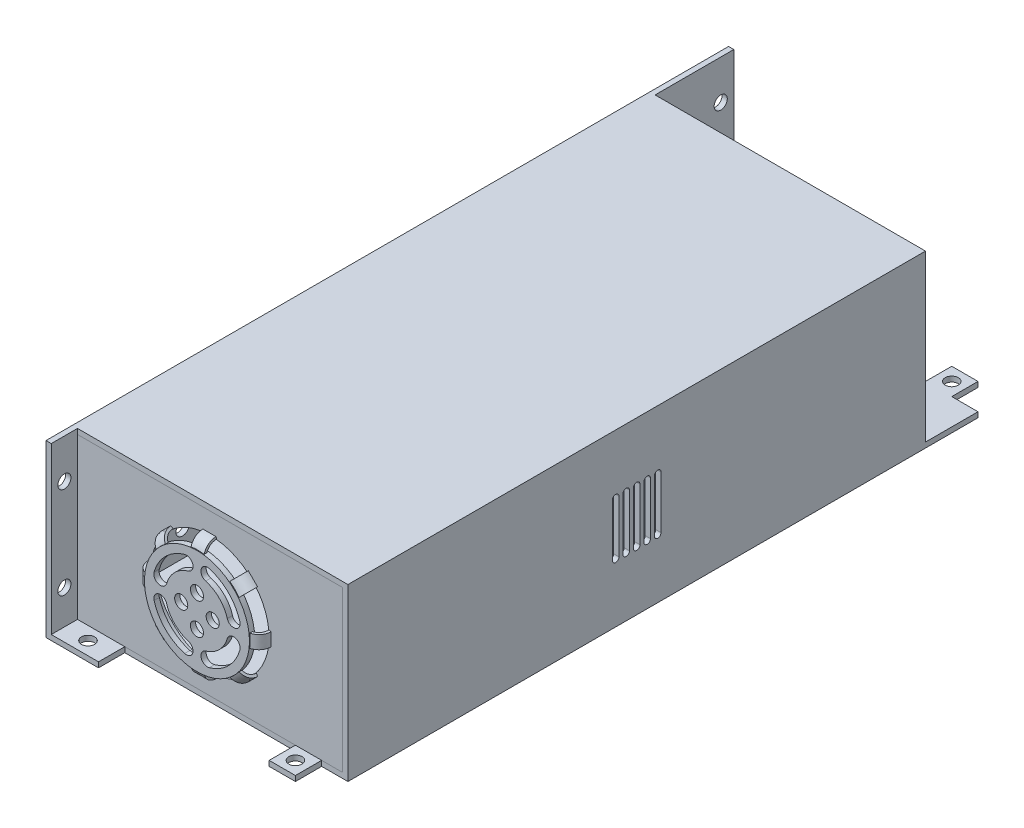
from build123d import *

# Parameters (mm, degrees)
BOARD_OUTLINE_DEPTH                    = 110
BOARD_OUTLINE_DEPTH_BACK               = 110
ESQUISSE1_W                            = 105
ESQUISSE1_H                            = 65
ESQUISSE1_W_2                          = 101
ESQUISSE1_H_2                          = 61
ESQUISSE8_W                            = 101
ESQUISSE8_H                            = 2
BOSS_EXTRU_3_DEPTH                     = 61
BOSS_EXTRU_3_2_DEPTH                   = 61
ESQUISSE2_W                            = 10
ESQUISSE2_H                            = 2
BOSS_EXTRU_2_DEPTH                     = 10
ESQUISSE9_R                            = 22.5
ENL_V_MAT_EXTRU_1_DEPTH                = 2
ESQUISSE10_R                           = 20
ESQUISSE10_R_2                         = 2.5
BOSS_EXTRU_4_DEPTH                     = 2
BALAYAGE4_START                        = -2.5
BALAYAGE4_DEPTH                        = 5
R_P_TITION_CIRCULAIRE8_COUNT           = 8
BOSS_EXTRU_6_DEPTH                     = 30
ESQUISSE17_W                           = 65
ESQUISSE17_H                           = 2
ESQUISSE17_W_2                         = 10
ENL_V_MAT_EXTRU_2_DEPTH                = 10
ESQUISSE18_W                           = 65
ESQUISSE18_H                           = 2
BOSS_EXTRU_7_DEPTH                     = 3
ESQUISSE19_W                           = 82
ESQUISSE19_H                           = 15
BOSS_EXTRU_8_DEPTH                     = 7.5
D_POUILLE2_ANGLE                       = 5
BOSS_EXTRU_10_START                    = -7.5
BOSS_EXTRU_10_DEPTH                    = 10.5
ENL_V_MAT_EXTRU_3_REACH                = 169.152
ENL_V_MAT_EXTRU_4_DEPTH                = 2
ENL_V_MAT_EXTRU_5_DEPTH                = 2
ESQUISSE7_W                            = 2.5
ESQUISSE7_H                            = 2
DIAM_TRE_DU_PER_AGE_5_0_5_2_AT_2_COUNT = 2
DIAM_TRE_DU_PER_AGE_5_0_5_2_AT_2_PITCH = 35
DIAM_TRE_DU_PER_AGE_5_0_5_2_AT_3_COUNT = 2
DIAM_TRE_DU_PER_AGE_5_0_5_2_AT_3_PITCH = 250
DIAM_TRE_DU_PER_AGE_5_0_5_2_AT_4_COUNT = 2
DIAM_TRE_DU_PER_AGE_5_0_5_2_AT_4_PITCH = 252.438111227
ESQUISSE5_W                            = 2.5
ESQUISSE5_H                            = 2
DIAM_TRE_DU_PER_AGE_5_0_5_1_AT_2_COUNT = 2
DIAM_TRE_DU_PER_AGE_5_0_5_1_AT_2_PITCH = 79
DIAM_TRE_DU_PER_AGE_5_0_5_1_AT_3_COUNT = 2
DIAM_TRE_DU_PER_AGE_5_0_5_1_AT_3_PITCH = 250
DIAM_TRE_DU_PER_AGE_5_0_5_1_AT_4_COUNT = 2
DIAM_TRE_DU_PER_AGE_5_0_5_1_AT_4_PITCH = 262.185049154
ESQUISSE24_R                           = 2.5
ENL_V_MAT_EXTRU_6_DEPTH                = 2


with BuildPart() as part:
    # Esquisse1 → Board_Outline (new, two sides: drawn at the far end of the back side and taken through both)
    with BuildSketch(Plane.XY.offset(-BOARD_OUTLINE_DEPTH_BACK)):
        Rectangle(ESQUISSE1_W, ESQUISSE1_H)
        Rectangle(ESQUISSE1_W_2, ESQUISSE1_H_2, mode=Mode.SUBTRACT)
    extrude(amount=BOARD_OUTLINE_DEPTH + BOARD_OUTLINE_DEPTH_BACK)

    # Esquisse2 → Boss.-Extru.2 (add)
    with BuildSketch(Plane.XY.offset(110)):
        Polygon((-52.5, 32.5), (-50.5, 32.5), (-50.5, -30.5), (-42.5, -30.5), (-32.5, -30.5), (-32.5, -32.5), (-52.5, -32.5), align=None)
        with Locations((37.5, -31.5)):
            Rectangle(ESQUISSE2_W, ESQUISSE2_H)
    extrude(amount=BOSS_EXTRU_2_DEPTH)



with BuildPart() as body_2:
    # Esquisse8 → Boss.-Extru.3 (new body)
    with BuildSketch(Plane(origin=(0, -30.5, 0), x_dir=(1, 0, 0), z_dir=(0, 1, 0))):
        with Locations((0, -109)):
            Rectangle(ESQUISSE8_W, ESQUISSE8_H)
    extrude(amount=BOSS_EXTRU_3_DEPTH)

    # Esquisse9 → Enlèv. mat.-Extru.1 (cut)
    with BuildSketch(Plane.XY.offset(110)):
        Circle(ESQUISSE9_R)
    extrude(amount=-ENL_V_MAT_EXTRU_1_DEPTH, mode=Mode.SUBTRACT)


with BuildPart() as body_3:
    # Esquisse8 → Boss.-Extru.3 2 (new body)
    with BuildSketch(Plane(origin=(0, -30.5, 0), x_dir=(1, 0, 0), z_dir=(0, 1, 0))):
        with Locations((0, 109)):
            Rectangle(ESQUISSE8_W, ESQUISSE8_H)
    extrude(amount=BOSS_EXTRU_3_2_DEPTH)


with BuildPart() as body_4:
    # Esquisse10 → Boss.-Extru.4 (new body)
    with BuildSketch(Plane.XY.offset(113)):
        Circle(ESQUISSE10_R)
        with Locations((-6, 0)):
            Circle(ESQUISSE10_R_2, mode=Mode.SUBTRACT)
        with Locations((0, -6)):
            Circle(ESQUISSE10_R_2, mode=Mode.SUBTRACT)
        with Locations((6, 0)):
            Circle(ESQUISSE10_R_2, mode=Mode.SUBTRACT)
        with Locations((0, 6)):
            Circle(ESQUISSE10_R_2, mode=Mode.SUBTRACT)
        with BuildLine():
            ThreePointArc((-16.340352945, 4.689655172), (-14.627015037, 1.59700692), (-11.534366785, 3.310344828))
            ThreePointArc((-11.534366785, 3.310344828), (-8.485281374, 8.485281374), (-3.310344828, 11.534366785))
            ThreePointArc((-3.310344828, 11.534366785), (-1.59700692, 14.627015037), (-4.689655172, 16.340352945))
            ThreePointArc((-4.689655172, 16.340352945), (-12.02081528, 12.02081528), (-16.340352945, 4.689655172))
        make_face(mode=Mode.SUBTRACT)
        with BuildLine():
            ThreePointArc((-4.689655172, -16.340352945), (-1.59700692, -14.627015037), (-3.310344828, -11.534366785))
            ThreePointArc((-3.310344828, -11.534366785), (-8.485281374, -8.485281374), (-11.534366785, -3.310344828))
            ThreePointArc((-11.534366785, -3.310344828), (-14.627015037, -1.59700692), (-16.340352945, -4.689655172))
            ThreePointArc((-16.340352945, -4.689655172), (-12.02081528, -12.02081528), (-4.689655172, -16.340352945))
        make_face(mode=Mode.SUBTRACT)
        with BuildLine():
            ThreePointArc((16.340352945, -4.689655172), (14.627015037, -1.59700692), (11.534366785, -3.310344828))
            ThreePointArc((11.534366785, -3.310344828), (8.485281374, -8.485281374), (3.310344828, -11.534366785))
            ThreePointArc((3.310344828, -11.534366785), (1.59700692, -14.627015037), (4.689655172, -16.340352945))
            ThreePointArc((4.689655172, -16.340352945), (12.02081528, -12.02081528), (16.340352945, -4.689655172))
        make_face(mode=Mode.SUBTRACT)
        with BuildLine():
            ThreePointArc((4.689655172, 16.340352945), (1.59700692, 14.627015037), (3.310344828, 11.534366785))
            ThreePointArc((3.310344828, 11.534366785), (8.485281374, 8.485281374), (11.534366785, 3.310344828))
            ThreePointArc((11.534366785, 3.310344828), (14.627015037, 1.59700692), (16.340352945, 4.689655172))
            ThreePointArc((16.340352945, 4.689655172), (12.02081528, 12.02081528), (4.689655172, 16.340352945))
        make_face(mode=Mode.SUBTRACT)
    extrude(amount=BOSS_EXTRU_4_DEPTH)

    # Balayage4: read off the stored shape, not the designer's step
    # Balayage4 outline → Balayage4 (add)
    with BuildSketch(Plane.YZ.offset(BALAYAGE4_START)):
        with BuildLine():
            Line((19.843134833, 114.77639353), (19.843134833, 113.741976702))
            add(Edge.make_bspline(
                [(19.843134833, 113.741976702), (21.544780484, 113.090833593), (22.422861696, 111.843508026), (22.477378468, 110)],
                knots=[0.133241365, 0.133241365, 0.133241365, 0.133241365, 1, 1, 1, 1], degree=3))
            Line((22.477378468, 110), (23.442609024, 110.261400026))
            add(Edge.make_bspline(
                [(19.843134833, 114.77639353), (20.750508789, 114.482186365), (21.536353529, 114.03620951), (22.928625588, 112.594403676), (23.365671369, 111.488628902), (23.442609024, 110.261400026)],
                knots=[0.114905145, 0.114905145, 0.114905145, 0.114905145, 0.5, 0.5, 1, 1, 1, 1], degree=3))
        make_face()
    balayage4 = extrude(amount=BALAYAGE4_DEPTH)

    # Répétition circulaire8: Balayage4 ×8 about axis
    r_p_tition_circulaire8_axis = Axis((0, 0, 113), (0, 0, 1))
    for i in range(1, R_P_TITION_CIRCULAIRE8_COUNT):
        add(balayage4.rotate(r_p_tition_circulaire8_axis, i * 360 / R_P_TITION_CIRCULAIRE8_COUNT))


with BuildPart() as part_1:
    add(part.part)

    add(body_3.part)  # Boss.-Extru.6 merges body 3
    # Esquisse15 → Boss.-Extru.6 (add)
    with BuildSketch(Plane(origin=(0, 0, -110), x_dir=(-1, 0, 0), z_dir=(0, 0, -1))):
        Polygon((-52.5, -32.5), (52.5, -32.5), (52.5, 32.5), (50.5, 32.5), (50.5, 30.5), (50.5, -30.5), (-50.5, -30.5), (-52.5, -30.5), align=None)
    extrude(amount=BOSS_EXTRU_6_DEPTH)

    # Esquisse17 → Enlèv. mat.-Extru.2 (cut)
    with BuildSketch(Plane(origin=(0, 0, -140), x_dir=(-1, 0, 0), z_dir=(0, 0, -1))):
        with Locations((0, -31.5)):
            Rectangle(ESQUISSE17_W, ESQUISSE17_H)
        with Locations((-47.5, -31.5)):
            Rectangle(ESQUISSE17_W_2, ESQUISSE17_H)
    extrude(amount=-ENL_V_MAT_EXTRU_2_DEPTH, mode=Mode.SUBTRACT)

    # Esquisse18 → Boss.-Extru.7 (add)
    with BuildSketch(Plane(origin=(0, -30.5, -99.5), x_dir=(-1, 0, 0), z_dir=(0, 1, 0))):
        with Locations((0, -29.5)):
            Rectangle(ESQUISSE18_W, ESQUISSE18_H)
    extrude(amount=BOSS_EXTRU_7_DEPTH)



with BuildPart() as body_4_2:
    # Esquisse19 → Boss.-Extru.8 (new body)
    with BuildSketch(Plane(origin=(0, -30.5, 0), x_dir=(1, 0, 0), z_dir=(0, 1, 0))):
        with Locations((-7.5, 119.5)):
            Rectangle(ESQUISSE19_W, ESQUISSE19_H)
    extrude(amount=BOSS_EXTRU_8_DEPTH)

    # Dépouille2
    d_pouille2_faces = [body_4_2.faces().sort_by_distance(p)[0] for p in [
        (-48.5, -26.75, -119.5),
        (-7.5, -26.75, -112),
        (-7.5, -26.75, -127),
        (33.5, -26.75, -119.5),
    ]]
    draft(d_pouille2_faces, Plane(origin=(-50.5, -30.5, -110), x_dir=(0, 0, 1), z_dir=(0, 1, 0)), D_POUILLE2_ANGLE)


with BuildPart() as part_2:
    add(part_1.part)

    add(body_4_2.part)  # Boss.-Extru.10 merges body 4 2
    # Boss.-Extru.10: read off the stored shape, not the designer's step
    # Boss.-Extru.10 outline → Boss.-Extru.10 (add)
    with BuildSketch(Plane(origin=(0, -23, 0), x_dir=(1, 0, 0), z_dir=(0, 1, 0)).offset(BOSS_EXTRU_10_START)):
        Polygon((-7.25, 126.343835024), (-7.75, 126.343835024), (-7.75, 113.156164976), (-17.273458756, 113.156164976), (-17.273458756, 126.343835024), (-17.773458756, 126.343835024), (-17.773458756, 113.156164976), (-27.296917512, 113.156164976), (-27.296917512, 126.343835024), (-27.796917512, 126.343835024), (-27.796917512, 113.156164976), (-37.320376268, 113.156164976), (-37.320376268, 126.343835024), (-37.820376268, 126.343835024), (-37.820376268, 113.156164976), (-47.343835024, 113.156164976), (-47.343835024, 126.343835024), (-47.843835024, 126.343835024), (-47.843835024, 112.656164976), (32.843835024, 112.656164976), (32.843835024, 126.343835024), (32.343835024, 126.343835024), (32.343835024, 113.156164976), (22.820376268, 113.156164976), (22.820376268, 126.343835024), (22.320376268, 126.343835024), (22.320376268, 113.156164976), (12.796917512, 113.156164976), (12.796917512, 126.343835024), (12.296917512, 126.343835024), (12.296917512, 113.156164976), (2.773458756, 113.156164976), (2.773458756, 126.343835024), (2.273458756, 126.343835024), (2.273458756, 113.156164976), (-7.25, 113.156164976), align=None)
    extrude(amount=BOSS_EXTRU_10_DEPTH)

    # Enlèv. mat.-Extru.3: up to this face of the body (flat: up to its plane)
    enl_v_mat_extru_3_end = Plane(part_2.part.faces().sort_by_distance((-47.843835024, -21.5, -119.5))[0])
    # Esquisse21 → Enlèv. mat.-Extru.3 (cut, up to the picked face)
    with BuildSketch(Plane(origin=(32.843835024, 0, 0), x_dir=(0, 0, -1), z_dir=(1, 0, 0)), mode=Mode.PRIVATE) as enl_v_mat_extru_3_sk1:
        with BuildLine():
            Line((122.847417788, -20), (126.343835024, -20))
            Line((126.343835024, -20), (126.343835024, -21.5))
            add(Edge.make_bspline(
                [(122.847417788, -20), (124.968577579, -20), (126.343835024, -21.5)],
                knots=[0, 0, 0, 1, 1, 1], degree=2))
        make_face()
    enl_v_mat_extru_3_tool1 = split(extrude(enl_v_mat_extru_3_sk1.sketch, amount=-ENL_V_MAT_EXTRU_3_REACH, mode=Mode.PRIVATE), bisect_by=enl_v_mat_extru_3_end, keep=Keep.BOTH, mode=Mode.PRIVATE)
    add(enl_v_mat_extru_3_tool1.solids().sort_by(Axis((32.843835, -20.43209, -125.523447), (-1, 0, 0)))[0], mode=Mode.SUBTRACT)

    # Esquisse22 → Enlèv. mat.-Extru.4 (cut)
    with BuildSketch(Plane(origin=(0, 0, -110), x_dir=(-1, 0, 0), z_dir=(0, 0, -1))):
        with BuildLine():
            Line((-33.75, 22.5), (-33.75, -22.5))
            ThreePointArc((-33.75, -22.5), (-32.5, -23.75), (-31.25, -22.5))
            Line((-31.25, -22.5), (-31.25, 22.5))
            ThreePointArc((-31.25, 22.5), (-32.5, 23.75), (-33.75, 22.5))
        make_face()
        with BuildLine():
            Line((-25.25, 22.5), (-25.25, -22.5))
            ThreePointArc((-25.25, -22.5), (-26.5, -23.75), (-27.75, -22.5))
            Line((-27.75, -22.5), (-27.75, 22.5))
            ThreePointArc((-27.75, 22.5), (-26.5, 23.75), (-25.25, 22.5))
        make_face()
        with BuildLine():
            Line((-19.25, 22.5), (-19.25, -22.5))
            ThreePointArc((-19.25, -22.5), (-20.5, -23.75), (-21.75, -22.5))
            Line((-21.75, -22.5), (-21.75, 22.5))
            ThreePointArc((-21.75, 22.5), (-20.5, 23.75), (-19.25, 22.5))
        make_face()
        with BuildLine():
            Line((-13.25, 22.5), (-13.25, -22.5))
            ThreePointArc((-13.25, -22.5), (-14.5, -23.75), (-15.75, -22.5))
            Line((-15.75, -22.5), (-15.75, 22.5))
            ThreePointArc((-15.75, 22.5), (-14.5, 23.75), (-13.25, 22.5))
        make_face()
        with BuildLine():
            Line((-7.25, 22.5), (-7.25, -22.5))
            ThreePointArc((-7.25, -22.5), (-8.5, -23.75), (-9.75, -22.5))
            Line((-9.75, -22.5), (-9.75, 22.5))
            ThreePointArc((-9.75, 22.5), (-8.5, 23.75), (-7.25, 22.5))
        make_face()
        with BuildLine():
            Line((-1.25, 22.5), (-1.25, -22.5))
            ThreePointArc((-1.25, -22.5), (-2.5, -23.75), (-3.75, -22.5))
            Line((-3.75, -22.5), (-3.75, 22.5))
            ThreePointArc((-3.75, 22.5), (-2.5, 23.75), (-1.25, 22.5))
        make_face()
        with BuildLine():
            Line((4.75, 22.5), (4.75, -22.5))
            ThreePointArc((4.75, -22.5), (3.5, -23.75), (2.25, -22.5))
            Line((2.25, -22.5), (2.25, 22.5))
            ThreePointArc((2.25, 22.5), (3.5, 23.75), (4.75, 22.5))
        make_face()
        with BuildLine():
            Line((10.75, 22.5), (10.75, -22.5))
            ThreePointArc((10.75, -22.5), (9.5, -23.75), (8.25, -22.5))
            Line((8.25, -22.5), (8.25, 22.5))
            ThreePointArc((8.25, 22.5), (9.5, 23.75), (10.75, 22.5))
        make_face()
        with BuildLine():
            Line((16.75, 22.5), (16.75, -22.5))
            ThreePointArc((16.75, -22.5), (15.5, -23.75), (14.25, -22.5))
            Line((14.25, -22.5), (14.25, 22.5))
            ThreePointArc((14.25, 22.5), (15.5, 23.75), (16.75, 22.5))
        make_face()
        with BuildLine():
            Line((22.75, 22.5), (22.75, -22.5))
            ThreePointArc((22.75, -22.5), (21.5, -23.75), (20.25, -22.5))
            Line((20.25, -22.5), (20.25, 22.5))
            ThreePointArc((20.25, 22.5), (21.5, 23.75), (22.75, 22.5))
        make_face()
        with BuildLine():
            Line((28.75, 22.5), (28.75, -22.5))
            ThreePointArc((28.75, -22.5), (27.5, -23.75), (26.25, -22.5))
            Line((26.25, -22.5), (26.25, 22.5))
            ThreePointArc((26.25, 22.5), (27.5, 23.75), (28.75, 22.5))
        make_face()
        with BuildLine():
            Line((34.75, 22.5), (34.75, -22.5))
            ThreePointArc((34.75, -22.5), (33.5, -23.75), (32.25, -22.5))
            Line((32.25, -22.5), (32.25, 22.5))
            ThreePointArc((32.25, 22.5), (33.5, 23.75), (34.75, 22.5))
        make_face()
        with BuildLine():
            Line((40.75, 22.5), (40.75, -22.5))
            ThreePointArc((40.75, -22.5), (39.5, -23.75), (38.25, -22.5))
            Line((38.25, -22.5), (38.25, 22.5))
            ThreePointArc((38.25, 22.5), (39.5, 23.75), (40.75, 22.5))
        make_face()
        with BuildLine():
            Line((46.75, 22.5), (46.75, -22.5))
            ThreePointArc((46.75, -22.5), (45.5, -23.75), (44.25, -22.5))
            Line((44.25, -22.5), (44.25, 22.5))
            ThreePointArc((44.25, 22.5), (45.5, 23.75), (46.75, 22.5))
        make_face()
    extrude(amount=-ENL_V_MAT_EXTRU_4_DEPTH, mode=Mode.SUBTRACT)

    # Esquisse23 → Enlèv. mat.-Extru.5 (cut)
    with BuildSketch(Plane(origin=(52.5, 0, 0), x_dir=(0, 0, -1), z_dir=(1, 0, 0))):
        with BuildLine():
            Line((-5.25, 10), (-5.25, -10))
            ThreePointArc((-5.25, -10), (-4, -11.25), (-2.75, -10))
            Line((-2.75, -10), (-2.75, 10))
            ThreePointArc((-2.75, 10), (-4, 11.25), (-5.25, 10))
        make_face()
        with BuildLine():
            Line((-9.25, 10), (-9.25, -10))
            ThreePointArc((-9.25, -10), (-8, -11.25), (-6.75, -10))
            Line((-6.75, -10), (-6.75, 10))
            ThreePointArc((-6.75, 10), (-8, 11.25), (-9.25, 10))
        make_face()
        with BuildLine():
            Line((-1.25, 10), (-1.25, -10))
            ThreePointArc((-1.25, -10), (0, -11.25), (1.25, -10))
            Line((1.25, -10), (1.25, 10))
            ThreePointArc((1.25, 10), (0, 11.25), (-1.25, 10))
        make_face()
        with BuildLine():
            Line((2.75, 10), (2.75, -10))
            ThreePointArc((2.75, -10), (4, -11.25), (5.25, -10))
            Line((5.25, -10), (5.25, 10))
            ThreePointArc((5.25, 10), (4, 11.25), (2.75, 10))
        make_face()
        with BuildLine():
            Line((6.75, 10), (6.75, -10))
            ThreePointArc((6.75, -10), (8, -11.25), (9.25, -10))
            Line((9.25, -10), (9.25, 10))
            ThreePointArc((9.25, 10), (8, 11.25), (6.75, 10))
        make_face()
    extrude(amount=-ENL_V_MAT_EXTRU_5_DEPTH, mode=Mode.SUBTRACT)

    # Esquisse7 → Diamètre du perçage Ø5.0 (5)2 (revolve, cut)
    with BuildSketch(Plane(origin=(-50.5, 17.5, 115), x_dir=(0, 0, -1), z_dir=(0, 1, 0))):
        with Locations((1.25, 1)):
            Rectangle(ESQUISSE7_W, ESQUISSE7_H)
    diam_tre_du_per_age_5_0_5_2 = revolve(axis=Axis((-44.15, 17.5, 115), (-1, 0, 0)), mode=Mode.SUBTRACT)

    # Diamètre du perçage Ø5.0 (5)2 at 2: Diamètre du perçage Ø5.0 (5)2 ×2
    with Locations(*[(0, -i * DIAM_TRE_DU_PER_AGE_5_0_5_2_AT_2_PITCH, 0) for i in range(1, DIAM_TRE_DU_PER_AGE_5_0_5_2_AT_2_COUNT)]):
        add(diam_tre_du_per_age_5_0_5_2, mode=Mode.SUBTRACT)

    # Diamètre du perçage Ø5.0 (5)2 at 3: Diamètre du perçage Ø5.0 (5)2 ×2
    with Locations(*[(0, 0, -i * DIAM_TRE_DU_PER_AGE_5_0_5_2_AT_3_PITCH) for i in range(1, DIAM_TRE_DU_PER_AGE_5_0_5_2_AT_3_COUNT)]):
        add(diam_tre_du_per_age_5_0_5_2, mode=Mode.SUBTRACT)

    # Diamètre du perçage Ø5.0 (5)2 at 4: Diamètre du perçage Ø5.0 (5)2 ×2
    with Locations(*[Vector(0, -0.13864784453440623, -0.9903417466743302) * (i * DIAM_TRE_DU_PER_AGE_5_0_5_2_AT_4_PITCH) for i in range(1, DIAM_TRE_DU_PER_AGE_5_0_5_2_AT_4_COUNT)]):
        add(diam_tre_du_per_age_5_0_5_2, mode=Mode.SUBTRACT)

    # Esquisse5 → Diamètre du perçage Ø5.0 (5)1 (revolve, cut)
    with BuildSketch(Plane(origin=(-41.5, -30.5, 115), x_dir=(0, 0, 1), z_dir=(1, 0, 0))):
        with Locations((1.25, 1)):
            Rectangle(ESQUISSE5_W, ESQUISSE5_H)
    diam_tre_du_per_age_5_0_5_1 = revolve(axis=Axis((-41.5, -24.15, 115), (0, -1, 0)), mode=Mode.SUBTRACT)

    # Diamètre du perçage Ø5.0 (5)1 at 2: Diamètre du perçage Ø5.0 (5)1 ×2
    with Locations(*[(i * DIAM_TRE_DU_PER_AGE_5_0_5_1_AT_2_PITCH, 0, 0) for i in range(1, DIAM_TRE_DU_PER_AGE_5_0_5_1_AT_2_COUNT)]):
        add(diam_tre_du_per_age_5_0_5_1, mode=Mode.SUBTRACT)

    # Diamètre du perçage Ø5.0 (5)1 at 3: Diamètre du perçage Ø5.0 (5)1 ×2
    with Locations(*[(0, 0, -i * DIAM_TRE_DU_PER_AGE_5_0_5_1_AT_3_PITCH) for i in range(1, DIAM_TRE_DU_PER_AGE_5_0_5_1_AT_3_COUNT)]):
        add(diam_tre_du_per_age_5_0_5_1, mode=Mode.SUBTRACT)

    # Diamètre du perçage Ø5.0 (5)1 at 4: Diamètre du perçage Ø5.0 (5)1 ×2
    with Locations(*[Vector(0.3013139012115516, 0, -0.9535250038340239) * (i * DIAM_TRE_DU_PER_AGE_5_0_5_1_AT_4_PITCH) for i in range(1, DIAM_TRE_DU_PER_AGE_5_0_5_1_AT_4_COUNT)]):
        add(diam_tre_du_per_age_5_0_5_1, mode=Mode.SUBTRACT)

    # Esquisse24 → Enlèv. mat.-Extru.6 (cut)
    with BuildSketch(Plane.ZY.offset(52.5)):
        with Locations(Location((-80, -20.5, 0), (0, 0, 270))):
            Circle(ESQUISSE24_R)
        with Locations(Location((-70, -20.5, 0), (0, 0, 270))):
            Circle(ESQUISSE24_R)
        with Locations(Location((-60, -20.5, 0), (0, 0, 270))):
            Circle(ESQUISSE24_R)
        with Locations(Location((-50, -20.5, 0), (0, 0, 270))):
            Circle(ESQUISSE24_R)
        with Locations(Location((-40, -20.5, 0), (0, 0, 270))):
            Circle(ESQUISSE24_R)
        with Locations(Location((80, -20.5, 0), (0, 0, 270))):
            Circle(ESQUISSE24_R)
        with Locations(Location((70, -20.5, 0), (0, 0, 270))):
            Circle(ESQUISSE24_R)
        with Locations(Location((60, -20.5, 0), (0, 0, 270))):
            Circle(ESQUISSE24_R)
        with Locations(Location((50, -20.5, 0), (0, 0, 270))):
            Circle(ESQUISSE24_R)
        with Locations(Location((40, -20.5, 0), (0, 0, 270))):
            Circle(ESQUISSE24_R)
    extrude(amount=-ENL_V_MAT_EXTRU_6_DEPTH, mode=Mode.SUBTRACT)


solid = Compound([body_2.part, body_4.part, part_2.part])
